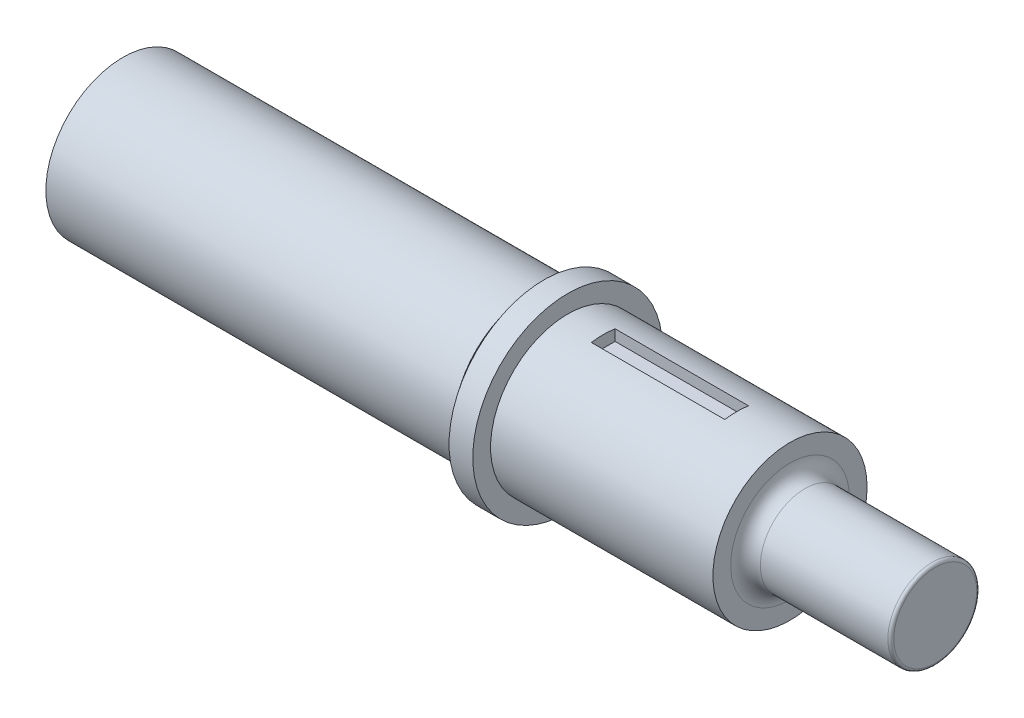
from build123d import *

# Parameters (mm, degrees)
SKETCH1_R                                = 26
BOSS_EXTRUDE1_DEPTH                      = 137.5
SKETCH2_R                                = 22
BOSS_EXTRUDE2_DEPTH                      = 4.5
SKETCH3_R                                = 32
BOSS_EXTRUDE3_DEPTH                      = 8
SKETCH4_R                                = 26
BOSS_EXTRUDE4_DEPTH                      = 75
F_12_0_12_DIAMETER_HOLE1_D               = 12
F_12_0_12_DIAMETER_HOLE1_DEPTH           = 20
F_12_0_12_DIAMETER_HOLE1_TIP             = 3.605163714
F_12_0_12_DIAMETER_HOLE1_ON_FACE_2_D     = 12
F_12_0_12_DIAMETER_HOLE1_ON_FACE_2_DEPTH = 20
F_12_0_12_DIAMETER_HOLE1_ON_FACE_2_TIP   = 3.605163714
SKETCH6_R                                = 15
BOSS_EXTRUDE5_DEPTH                      = 49
FILLET2_R                                = 5
CUT_EXTRUDE1_START                       = 26
SKETCH7_W                                = 45
SKETCH7_H                                = 8
CUT_EXTRUDE1_DEPTH                       = 4
M8_CLEARANCE_HOLE1_D                     = 8.4
M8_CLEARANCE_HOLE1_DEPTH                 = 13
M8_CLEARANCE_HOLE1_TIP                   = 2.5236146
FILLET3_R                                = 1


with BuildPart() as part:
    # Sketch1 → Boss-Extrude1 (new body)
    with BuildSketch(Plane(origin=(0, 0, 0), x_dir=(0, 0, -1), z_dir=(1, 0, 0))):
        Circle(SKETCH1_R)
    extrude(amount=BOSS_EXTRUDE1_DEPTH)

    # Sketch2 → Boss-Extrude2 (add)
    with BuildSketch(Plane(origin=(137.5, 0, 0), x_dir=(0, 0, -1), z_dir=(1, 0, 0))):
        Circle(SKETCH2_R)
    extrude(amount=BOSS_EXTRUDE2_DEPTH)

    # Sketch3 → Boss-Extrude3 (add)
    with BuildSketch(Plane(origin=(142, 0, 0), x_dir=(0, 0, -1), z_dir=(1, 0, 0))):
        Circle(SKETCH3_R)
    extrude(amount=BOSS_EXTRUDE3_DEPTH)

    # Sketch4 → Boss-Extrude4 (add)
    with BuildSketch(Plane(origin=(150, 0, 0), x_dir=(0, 0, -1), z_dir=(1, 0, 0))):
        Circle(SKETCH4_R)
    extrude(amount=BOSS_EXTRUDE4_DEPTH)

    # Ø12.0 (12) Diameter Hole1
    with Locations(Plane(origin=(0, 0, 0), x_dir=(0, 0, -1), z_dir=(-1, 0, 0))):
        with Locations((0, 0)):
            Hole(F_12_0_12_DIAMETER_HOLE1_D / 2, depth=F_12_0_12_DIAMETER_HOLE1_DEPTH)
            with Locations((0, 0, -(F_12_0_12_DIAMETER_HOLE1_DEPTH + F_12_0_12_DIAMETER_HOLE1_TIP / 2))):  # 118° drill point
                Cone(0, F_12_0_12_DIAMETER_HOLE1_D / 2, F_12_0_12_DIAMETER_HOLE1_TIP, mode=Mode.SUBTRACT)

    # Ø12.0 (12) Diameter Hole1 on face 2
    with Locations(Plane(origin=(-153.563701333, 12.350945858, 0), x_dir=(0, 0, -1), z_dir=(-1, 0, 0))):
        with Locations((0, 0)):
            Hole(F_12_0_12_DIAMETER_HOLE1_ON_FACE_2_D / 2, depth=F_12_0_12_DIAMETER_HOLE1_ON_FACE_2_DEPTH)
            with Locations((0, 0, -(F_12_0_12_DIAMETER_HOLE1_ON_FACE_2_DEPTH + F_12_0_12_DIAMETER_HOLE1_ON_FACE_2_TIP / 2))):  # 118° drill point
                Cone(0, F_12_0_12_DIAMETER_HOLE1_ON_FACE_2_D / 2, F_12_0_12_DIAMETER_HOLE1_ON_FACE_2_TIP, mode=Mode.SUBTRACT)

    # Sketch6 → Boss-Extrude5 (add)
    with BuildSketch(Plane(origin=(225, 0, 0), x_dir=(0, 0, -1), z_dir=(1, 0, 0))):
        Circle(SKETCH6_R)
    extrude(amount=BOSS_EXTRUDE5_DEPTH)

    # Fillet2
    fillet2_edges = [part.edges().sort_by_distance(p)[0] for p in [
        (225, 0, 15),
    ]]
    fillet(fillet2_edges, radius=FILLET2_R)

    # Sketch7 → Cut-Extrude1 (cut)
    with BuildSketch(Plane(origin=(0, 0, 0), x_dir=(1, 0, 0), z_dir=(0, 1, 0)).offset(CUT_EXTRUDE1_START)):
        with Locations((184.5, 0)):
            Rectangle(SKETCH7_W, SKETCH7_H)
    extrude(amount=-CUT_EXTRUDE1_DEPTH, mode=Mode.SUBTRACT)

    # M8 Clearance Hole1
    with Locations(Plane.ZY):
        with Locations((0, -16)):
            Hole(M8_CLEARANCE_HOLE1_D / 2, depth=M8_CLEARANCE_HOLE1_DEPTH)
            with Locations((0, 0, -(M8_CLEARANCE_HOLE1_DEPTH + M8_CLEARANCE_HOLE1_TIP / 2))):  # 118° drill point
                Cone(0, M8_CLEARANCE_HOLE1_D / 2, M8_CLEARANCE_HOLE1_TIP, mode=Mode.SUBTRACT)

    # Fillet3
    fillet3_edges = [part.edges().sort_by_distance(p)[0] for p in [
        (274, 0, 15),
    ]]
    fillet(fillet3_edges, radius=FILLET3_R)


solid = part.part
